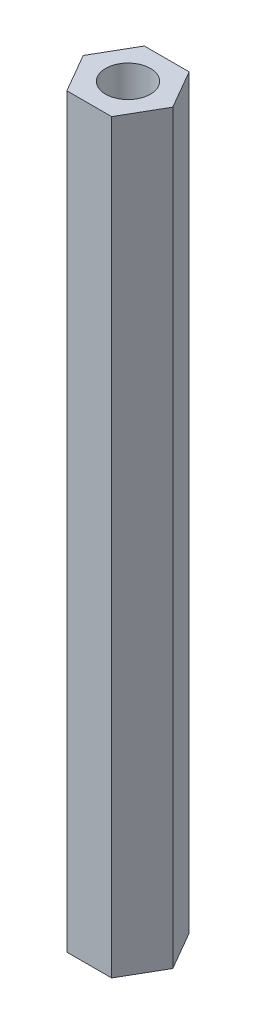
from build123d import *

# Parameters (mm, degrees)
SKETCH1_R           = 1.5
BOSS_EXTRUDE1_DEPTH = 50


with BuildPart() as part:
    # Sketch1 → Boss-Extrude1 (new body)
    with BuildSketch(Plane(origin=(0, 0, 0), x_dir=(1, 0, 0), z_dir=(0, 1, 0))):
        Polygon((1.5, 2.598076211), (-1.5, 2.598076211), (-3, 0), (-1.5, -2.598076211), (1.5, -2.598076211), (3, 0), align=None)
        Circle(SKETCH1_R, mode=Mode.SUBTRACT)
    extrude(amount=BOSS_EXTRUDE1_DEPTH)


solid = part.part
